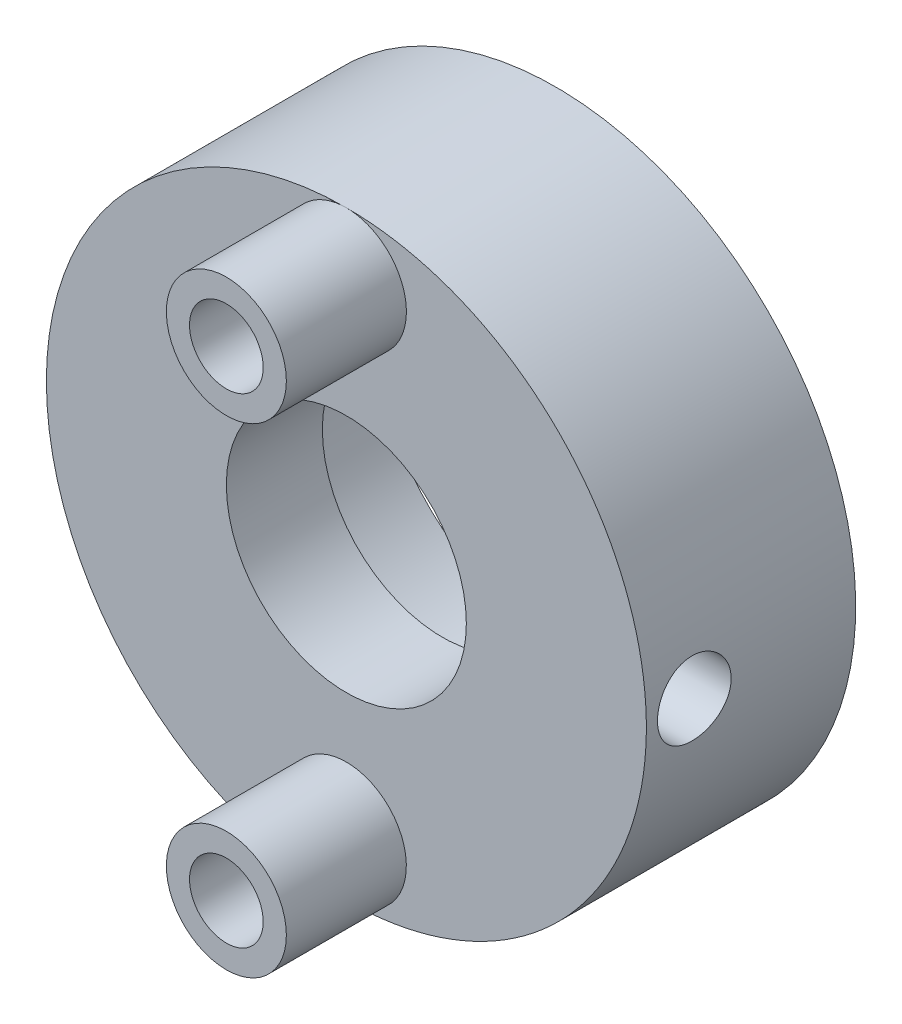
from build123d import *

# Parameters (mm, degrees)
SKETCH1_R               = 15.875
SKETCH1_R_2             = 1.95
SKETCH1_R_3             = 6.35
BOSS_EXTRUDE1_DEPTH     = 5.08
BOSS_EXTRUDE2_START     = 6.35
SKETCH1_3_R             = 3.175
SKETCH1_3_R_2           = 1.95
BOSS_EXTRUDE2_DEPTH     = 6.35
SKETCH2_R               = 15.875
SKETCH2_R_2             = 9.5
BOSS_EXTRUDE3_DEPTH     = 6
CUT_EXTRUDE1_REACH      = 47.59
CUT_EXTRUDE1_END_RADIUS = 6.35
SKETCH3_R               = 1.95


with BuildPart() as part:
    # Sketch1 → Boss-Extrude1 (new body)
    with BuildSketch(Plane.XY):
        Circle(SKETCH1_R)
        with Locations((0, 12.7)):
            Circle(SKETCH1_R_2, mode=Mode.SUBTRACT)
        Circle(SKETCH1_R_3, mode=Mode.SUBTRACT)
        with Locations((0, -12.7)):
            Circle(SKETCH1_R_2, mode=Mode.SUBTRACT)
    extrude(amount=-BOSS_EXTRUDE1_DEPTH)

    # Sketch1<3> → Boss-Extrude2 (add)
    # profile 1 of 2: a face of its own
    with BuildSketch(Plane.XY.offset(BOSS_EXTRUDE2_START)):
        with Locations((0, 12.7)):
            Circle(SKETCH1_3_R)
        with Locations((0, 12.7)):
            Circle(SKETCH1_3_R_2, mode=Mode.SUBTRACT)
    # profile 2 of 2: a face of its own
    with BuildSketch(Plane.XY.offset(BOSS_EXTRUDE2_START)):
        with Locations((0, -12.7)):
            Circle(SKETCH1_3_R)
        with Locations((0, -12.7)):
            Circle(SKETCH1_3_R_2, mode=Mode.SUBTRACT)
    extrude(amount=-BOSS_EXTRUDE2_DEPTH)

    # Sketch2 → Boss-Extrude3 (add)
    with BuildSketch(Plane(origin=(0, 0, -5.08), x_dir=(-1, 0, 0), z_dir=(0, 0, -1))):
        Circle(SKETCH2_R)
        Circle(SKETCH2_R_2, mode=Mode.SUBTRACT)
    extrude(amount=BOSS_EXTRUDE3_DEPTH)

    # Cut-Extrude1: up to this cylinder (the profile starts outside it)
    cut_extrude1_end = Plane(origin=(0, 0, -2.54), z_dir=(0, 0, 1)) * Cylinder(CUT_EXTRUDE1_END_RADIUS, 108.88, mode=Mode.PRIVATE)
    # Sketch3 → Cut-Extrude1 (cut, up to the surface)
    with BuildSketch(Plane(origin=(25.4, 0, 0), x_dir=(0, 0, -1), z_dir=(1, 0, 0)), mode=Mode.PRIVATE) as cut_extrude1_sk1:
        with Locations((2.54, 0)):
            Circle(SKETCH3_R)
    cut_extrude1_tool1 = extrude(cut_extrude1_sk1.sketch, amount=-CUT_EXTRUDE1_REACH, mode=Mode.PRIVATE) - cut_extrude1_end
    add(cut_extrude1_tool1.solids().sort_by_distance((25.4, 0, -2.54))[0], mode=Mode.SUBTRACT)


solid = part.part
